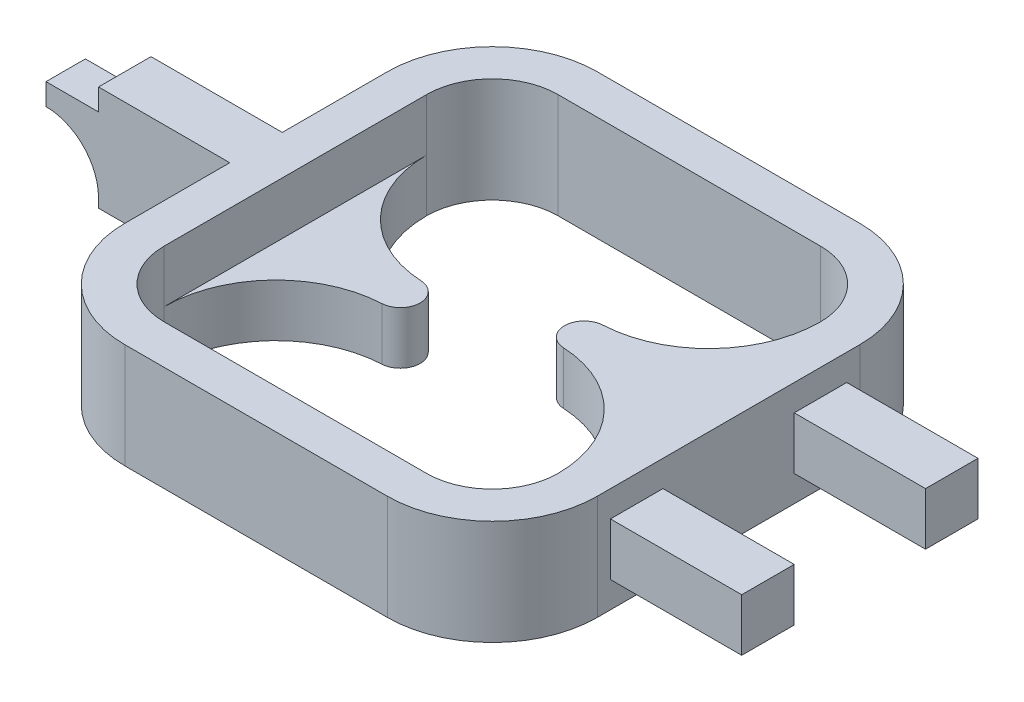
from build123d import *

# Parameters (mm, degrees)
BOSS_EXTRUDE1_DEPTH = 8
BOSS_EXTRUDE2_DEPTH = 4
SKETCH3_W           = 18
SKETCH3_H           = 2
CUT_EXTRUDE1_DEPTH  = 10
FILLET1_R           = 4
SKETCH4_W           = 9.5
SKETCH4_H           = 20
CUT_EXTRUDE2_DEPTH  = 4
SKETCH5_W           = 9.5
SKETCH5_H           = 20
CUT_EXTRUDE3_DEPTH  = 4


with BuildPart() as part:
    # Sketch1 → Boss-Extrude1 (new body)
    with BuildSketch(Plane(origin=(0, 0, 0), x_dir=(1, 0, 0), z_dir=(0, 1, 0))):
        with BuildLine():
            Line((-18, -10), (-18, -2))
            Line((-18, -2), (-28, -2))
            Line((-28, -2), (-28, 2))
            Line((-28, 2), (-18, 2))
            Line((-18, 2), (-18, 10))
            ThreePointArc((-18, 10), (-15.656854249, 15.656854249), (-10, 18))
            Line((-10, 18), (10, 18))
            ThreePointArc((10, 18), (15.656854249, 15.656854249), (18, 10))
            Line((18, 10), (18, 9))
            Line((18, 9), (28, 9))
            Line((28, 9), (28, 5))
            Line((28, 5), (18, 5))
            Line((18, 5), (18, -5))
            Line((18, -5), (28, -5))
            Line((28, -5), (28, -9))
            Line((28, -9), (18, -9))
            Line((18, -9), (18, -10))
            ThreePointArc((18, -10), (15.656854249, -15.656854249), (10, -18))
            Line((10, -18), (-10, -18))
            ThreePointArc((-10, -18), (-15.656854249, -15.656854249), (-18, -10))
        make_face()
        with BuildLine():
            Line((-10, -15), (10, -15))
            ThreePointArc((10, -15), (13.535533906, -13.535533906), (15, -10))
            ThreePointArc((15, -10), (12.658876757, -4.136567081), (6.923127464, -1.498028909))
            ThreePointArc((6.923127464, -1.498028909), (5.5, 0), (6.923127464, 1.498028909))
            ThreePointArc((6.923127464, 1.498028909), (12.658876757, 4.136567081), (15, 10))
            ThreePointArc((15, 10), (13.535533906, 13.535533906), (10, 15))
            Line((10, 15), (-10, 15))
            ThreePointArc((-10, 15), (-13.535533906, 13.535533906), (-15, 10))
            ThreePointArc((-15, 10), (-12.658876757, 4.136567081), (-6.923127464, 1.498028909))
            ThreePointArc((-6.923127464, 1.498028909), (-5.5, 0), (-6.923127464, -1.498028909))
            ThreePointArc((-6.923127464, -1.498028909), (-12.658876757, -4.136567081), (-15, -10))
            ThreePointArc((-15, -10), (-13.535533906, -13.535533906), (-10, -15))
        make_face(mode=Mode.SUBTRACT)
    extrude(amount=BOSS_EXTRUDE1_DEPTH)

    # Sketch2 → Boss-Extrude2 (add)
    with BuildSketch(Plane.ZY.offset(28)):
        Polygon((-1, 6.35), (2, 6.35), (2, 4.7), (-2, 4.7), (-2, 5.35), align=None)
    extrude(amount=BOSS_EXTRUDE2_DEPTH)

    # Sketch3 → Cut-Extrude1 (cut)
    with BuildSketch(Plane(origin=(28, 0, 0), x_dir=(0, 0, -1), z_dir=(1, 0, 0))):
        with Locations((0, 1)):
            Rectangle(SKETCH3_W, SKETCH3_H)
        with Locations((0, 7)):
            Rectangle(SKETCH3_W, SKETCH3_H)
    extrude(amount=-CUT_EXTRUDE1_DEPTH, mode=Mode.SUBTRACT)

    # Fillet1
    fillet1_edges = [part.edges().sort_by_distance(p)[0] for p in [
        (-28, 4.7, 0),
    ]]
    fillet(fillet1_edges, radius=FILLET1_R - 0.0001)  # a hair under: the kernel refuses the full size

    # Sketch4 → Cut-Extrude2 (cut)
    with BuildSketch(Plane.XZ):
        with Locations((10.25, 0)):
            Rectangle(SKETCH4_W, SKETCH4_H)
    extrude(amount=-CUT_EXTRUDE2_DEPTH, mode=Mode.SUBTRACT)

    # Sketch5 → Cut-Extrude3 (cut)
    with BuildSketch(Plane(origin=(0, 8, 0), x_dir=(1, 0, 0), z_dir=(0, 1, 0))):
        with Locations((-10.25, 0)):
            Rectangle(SKETCH5_W, SKETCH5_H)
    extrude(amount=-CUT_EXTRUDE3_DEPTH, mode=Mode.SUBTRACT)


solid = part.part
